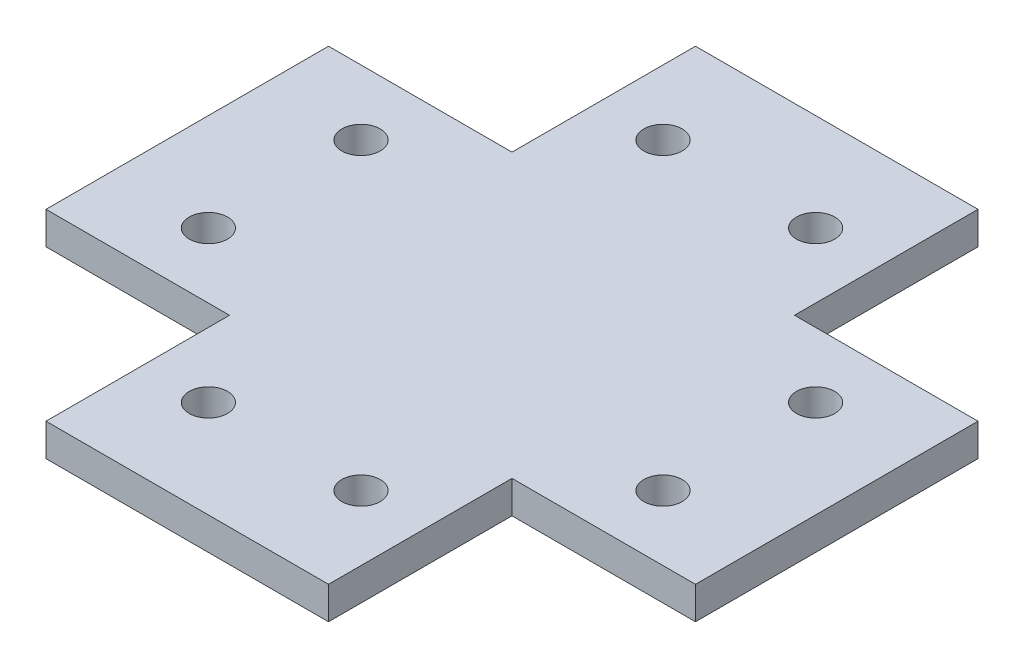
from build123d import *

# Parameters (mm, degrees)
SKETCH1_R           = 1.5
BOSS_EXTRUDE1_DEPTH = 2.54


with BuildPart() as part:
    # Sketch1 → Boss-Extrude1 (new body)
    with BuildSketch(Plane(origin=(0, 0, 0), x_dir=(1, 0, 0), z_dir=(0, 1, 0))):
        Polygon((-11.049, 11.049), (-25.4, 11.049), (-25.4, -11.049), (-11.049, -11.049), (-11.049, -25.4), (11.049, -25.4), (11.049, -11.049), (25.4, -11.049), (25.4, 11.049), (11.049, 11.049), (11.049, 25.4), (-11.049, 25.4), align=None)
        with Locations((-17.78, -5.969)):
            Circle(SKETCH1_R, mode=Mode.SUBTRACT)
        with Locations((-17.78, 5.969)):
            Circle(SKETCH1_R, mode=Mode.SUBTRACT)
        with Locations((5.969, 17.78)):
            Circle(SKETCH1_R, mode=Mode.SUBTRACT)
        with Locations((-5.969, 17.78)):
            Circle(SKETCH1_R, mode=Mode.SUBTRACT)
        with Locations((17.78, 5.969)):
            Circle(SKETCH1_R, mode=Mode.SUBTRACT)
        with Locations((17.78, -5.969)):
            Circle(SKETCH1_R, mode=Mode.SUBTRACT)
        with Locations((5.969, -17.78)):
            Circle(SKETCH1_R, mode=Mode.SUBTRACT)
        with Locations((-5.969, -17.78)):
            Circle(SKETCH1_R, mode=Mode.SUBTRACT)
    extrude(amount=BOSS_EXTRUDE1_DEPTH)


solid = part.part
